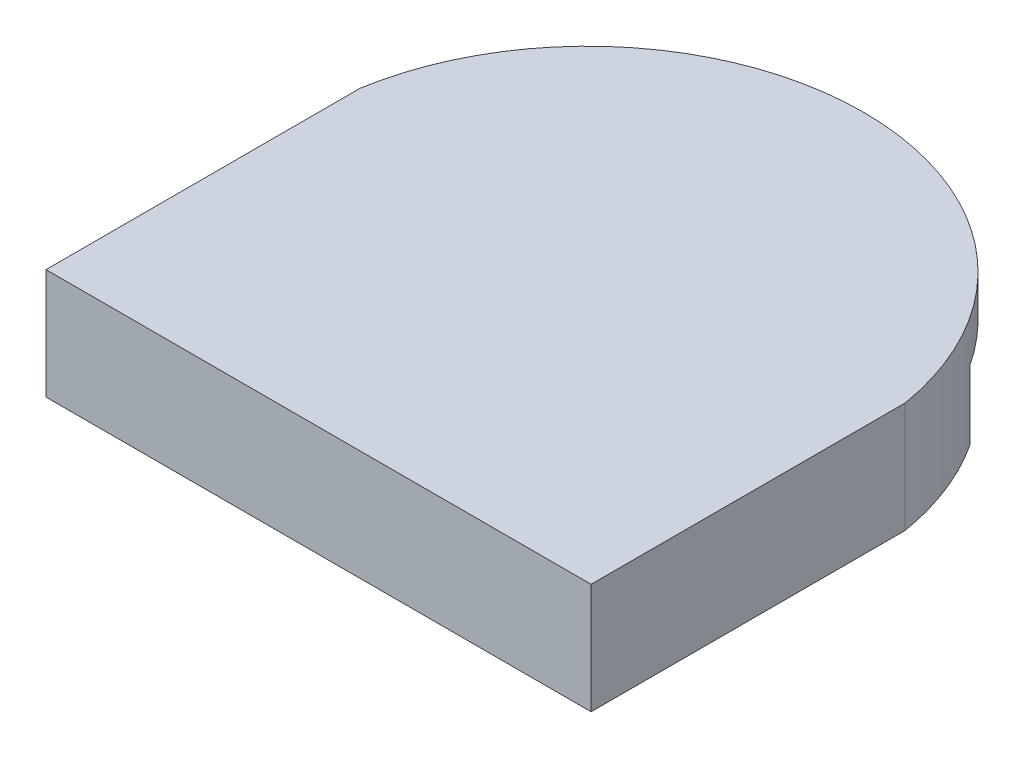
from build123d import *

# Parameters (mm, degrees)
MAINBASESKETCH_W          = 15.8
MAINBASESKETCH_H          = 3.2
MAINBASEEXTRUDE_DEPTH     = 7.9
MAINBASESHELL_T           = -1.2
UNDERSIDECIRCLEEXT_START  = -0.2
UNDERSIDECIRCLESKETCH_R   = 3.15
UNDERSIDECIRCLESKETCH_R_2 = 2.4
UNDERSIDECIRCLEEXT_DEPTH  = 1.6
CUT_EXTRUDE21_DEPTH       = 19.555463972
SWEEP13_DEPTH             = 3


with BuildPart() as part:
    # MainBaseSketch → MainBaseExtrude (new, symmetric)
    with BuildSketch(Plane.XY):
        with Locations((8.581967213, 1.6)):
            Rectangle(MAINBASESKETCH_W, MAINBASESKETCH_H)
    extrude(amount=MAINBASEEXTRUDE_DEPTH, both=True)

    # MainBaseShell
    mainbaseshell_openings = [part.faces().sort_by_distance(p)[0] for p in [
        (8.581967213, 0, 0),
    ]]
    offset(amount=MAINBASESHELL_T, openings=mainbaseshell_openings, kind=Kind.INTERSECTION)

    # UnderSideCircleSketch → UnderSideCircleExt (add)
    with BuildSketch(Plane.XZ.offset(-2).offset(UNDERSIDECIRCLEEXT_START)):
        with Locations((8.581967213, 0)):
            Circle(UNDERSIDECIRCLESKETCH_R)
        with Locations((8.581967213, 0)):
            Circle(UNDERSIDECIRCLESKETCH_R_2, mode=Mode.SUBTRACT)
    extrude(amount=UNDERSIDECIRCLEEXT_DEPTH)

    # Sketch70 → Cut-Extrude21 (cut, through all)
    with BuildSketch(Plane(origin=(0, 3.2, 0), x_dir=(1, 0, 0), z_dir=(0, 1, 0))):
        with BuildLine():
            Line((8.581967213, 7.9), (16.481967213, 7.9))
            Line((16.481967213, 7.9), (16.481967213, 1.203021508))
            ThreePointArc((16.481967213, 1.203021508), (13.76027584, 6.000468394), (8.581967213, 7.9))
        make_face()
    cut_extrude21 = extrude(amount=-CUT_EXTRUDE21_DEPTH, mode=Mode.SUBTRACT)

    # Mirror7: Cut-Extrude21 across plane
    add(cut_extrude21.mirror(Plane.ZY.offset(-8.581967213)), mode=Mode.SUBTRACT)

    # Sweep8: sweep along a curve in space
    with BuildLine() as sweep8_path:
        Line((15.281967213, 0, -4.27816573), (15.281967213, 2, -4.27816573))
    # Sketch75 → Sweep8 (sweep)
    with BuildSketch(Plane(origin=(0, 0, 0), x_dir=(-1, 0, 0), z_dir=(0, -1, 0))):
        with BuildLine():
            Line((-15.281967213, 4.27816573), (-15.281967213, 0))
            ThreePointArc((-15.281967213, 0), (-15.050769738, 1.744876469), (-14.373133216, 3.369331733))
            Line((-14.373133216, 3.369331733), (-15.281967213, 4.27816573))
        make_face()
        with BuildLine():
            Line((-12.798521236, 6.7), (-11.912237665, 5.813716429))
            ThreePointArc((-11.912237665, 5.813716429), (-10.305060351, 6.474638989), (-8.581967213, 6.7))
            Line((-8.581967213, 6.7), (-12.798521236, 6.7))
        make_face()
    sweep(path=sweep8_path.line)

    # Sweep13: read off the stored shape, not the designer's step
    # Sweep13 outline → Sweep13 (add)
    with BuildSketch(Plane(origin=(0, 0, 0), x_dir=(1, 0, 0), z_dir=(0, 1, 0))):
        with BuildLine():
            ThreePointArc((8.581967213, 6.7), (10.305060351, 6.474638989), (11.912237665, 5.813716429))
            Line((11.912237665, 5.813716429), (12.798521236, 6.7))
            ThreePointArc((12.798521236, 6.7), (8.581967213, 7.9), (4.36541319, 6.7))
            Line((4.36541319, 6.7), (5.249626829, 5.815786361))
            ThreePointArc((5.249626829, 5.815786361), (6.857925652, 6.4759933), (8.581967213, 6.7))
        make_face()
        with BuildLine():
            ThreePointArc((1.881967213, 4.27816573), (1.121797778, 2.803095833), (0.681967213, 1.203021508))
            Line((0.681967213, 1.203021508), (0.681967213, -7.9))
            Line((0.681967213, -7.9), (16.481967213, -7.9))
            Line((16.481967213, -7.9), (16.481967213, 1.203021508))
            ThreePointArc((16.481967213, 1.203021508), (16.042136648, 2.803095833), (15.281967213, 4.27816573))
            Line((15.281967213, 4.27816573), (14.373133216, 3.369331733))
            ThreePointArc((14.373133216, 3.369331733), (15.050769738, 1.744876469), (15.281967213, 0))
            Line((15.281967213, 0), (15.281967213, -6.7))
            Line((15.281967213, -6.7), (1.881967213, -6.7))
            Line((1.881967213, -6.7), (1.881967213, 0))
            ThreePointArc((1.881967213, 0), (2.113164688, 1.744876469), (2.79080121, 3.369331733))
            Line((2.79080121, 3.369331733), (1.881967213, 4.27816573))
        make_face()
    extrude(amount=SWEEP13_DEPTH)


solid = part.part
